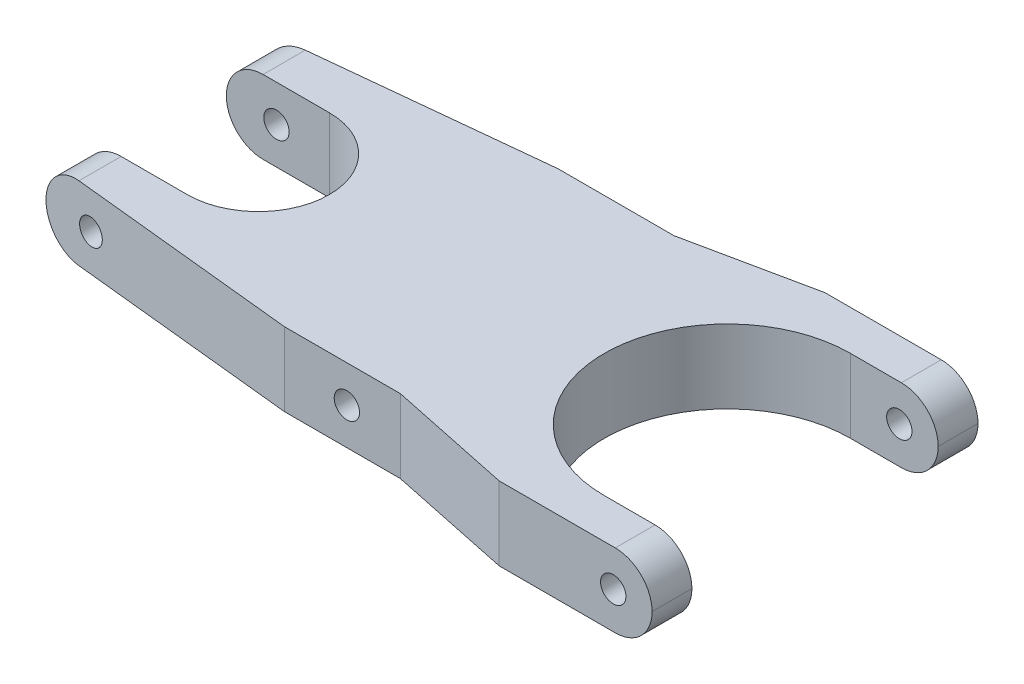
from build123d import *

# Parameters (mm, degrees)
SKETCH2_W           = 91.08348254
SKETCH2_H           = 10.16
SKETCH2_R           = 1.75
BOSS_EXTRUDE1_DEPTH = 22.5
CUT_EXTRUDE1_DEPTH  = 88.707853004
FILLET1_R           = 5.08


with BuildPart() as part:
    # Sketch2 → Boss-Extrude1 (new, symmetric)
    with BuildSketch(Plane.XY):
        with Locations((38.619959512, 0)):
            Rectangle(SKETCH2_W, SKETCH2_H)
        with Locations(Location((38.410945338, 0, 0), (0, 0, 180))):
            Circle(SKETCH2_R, mode=Mode.SUBTRACT)
        with Locations(Location((0, 0, 0), (0, 0, 180))):
            Circle(SKETCH2_R, mode=Mode.SUBTRACT)
        with Locations(Location((78.79999988, 0, 0), (0, 0, 180))):
            Circle(SKETCH2_R, mode=Mode.SUBTRACT)
    extrude(amount=BOSS_EXTRUDE1_DEPTH, both=True)

    # Sketch3 → Cut-Extrude1 (cut, through all)
    with BuildSketch(Plane(origin=(0, 5.08, 0), x_dir=(1, 0, 0), z_dir=(0, 1, 0))):
        with BuildLine():
            Line((91.724321271, 17), (72.05824076, 17))
            ThreePointArc((72.05824076, 17), (55.05824076, 0), (72.05824076, -17))
            Line((72.05824076, -17), (91.724321271, -17))
            Line((91.724321271, -17), (91.724321271, 17))
        make_face()
        Polygon((-6.921781758, 15.097756516), (29.791957943, 18.888274186), (45.800007469, 18.888274186), (63.048045595, 22.5), (63.048045595, 41.563803389), (-6.921781758, 41.563803389), align=None)
        with BuildLine():
            Line((-35.26716372, 9.799999958), (7.296822355, 9.799999958))
            ThreePointArc((7.296822355, 9.799999958), (17.096822313, 0), (7.296822355, -9.799999958))
            Line((7.296822355, -9.799999958), (-35.26716372, -9.799999958))
            Line((-35.26716372, -9.799999958), (-35.26716372, 9.799999958))
        make_face()
        Polygon((63.048045595, -22.5), (63.048045595, -41.563803389), (-6.921781758, -41.563803389), (-6.921781758, -15.097756516), (29.791957943, -18.888274186), (45.800007469, -18.888274186), align=None)
    extrude(amount=-CUT_EXTRUDE1_DEPTH, mode=Mode.SUBTRACT)

    # Fillet1
    fillet1_edges = [part.edges().sort_by_distance(p)[0] for p in [
        (-6.921781758, 5.08, -12.448878237),
        (-6.921781758, -5.08, -12.448878237),
        (-6.921781758, -5.08, 12.448878237),
        (-6.921781758, 5.08, 12.448878237),
        (84.161700782, -5.08, -19.75),
        (84.161700782, -5.08, 19.75),
        (84.161700782, 5.08, 19.75),
        (84.161700782, 5.08, -19.75),
    ]]
    fillet(fillet1_edges, radius=FILLET1_R - 0.0001)  # a hair under: the kernel refuses the full size


solid = part.part
